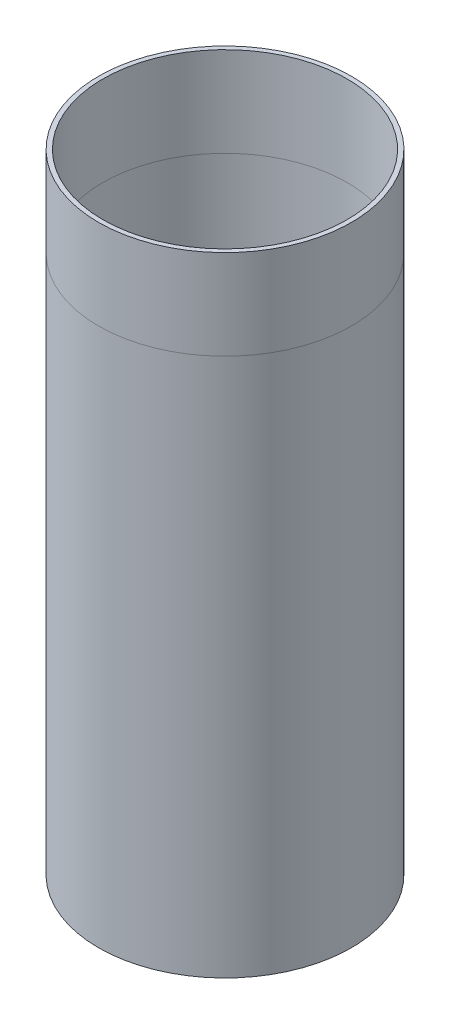
from build123d import *

# Parameters (mm, degrees)
SKETCH2_R           = 70.5
SKETCH2_R_2         = 68
BOSS_EXTRUDE1_DEPTH = 175


# Read off the part's stored shape, not the designer's step: Split1
with BuildPart() as part:
    # Sketch2 → Boss-Extrude1 (new, symmetric)
    with BuildSketch(Plane(origin=(0, 0, 0), x_dir=(1, 0, 0), z_dir=(0, 1, 0))):
        with Locations(Location((0, 0, 0), (0, 0, 270))):
            Circle(SKETCH2_R)
        with Locations(Location((0, 0, 0), (0, 0, 270))):
            Circle(SKETCH2_R_2, mode=Mode.SUBTRACT)
    extrude(amount=BOSS_EXTRUDE1_DEPTH, both=True)


with BuildPart() as body_2:
    # Split1: the piece on the far side of the plane
    add(part.part)
    split(bisect_by=Plane(origin=(0, 125, 0), x_dir=(1, 0, 0), z_dir=(0, 1, 0)), keep=Keep.BOTTOM)


with BuildPart() as part_1:
    add(part.part)

    # Split1
    split(bisect_by=Plane(origin=(0, 125, 0), x_dir=(1, 0, 0), z_dir=(0, 1, 0)), keep=Keep.TOP)


solid = Compound([body_2.part, part_1.part])
